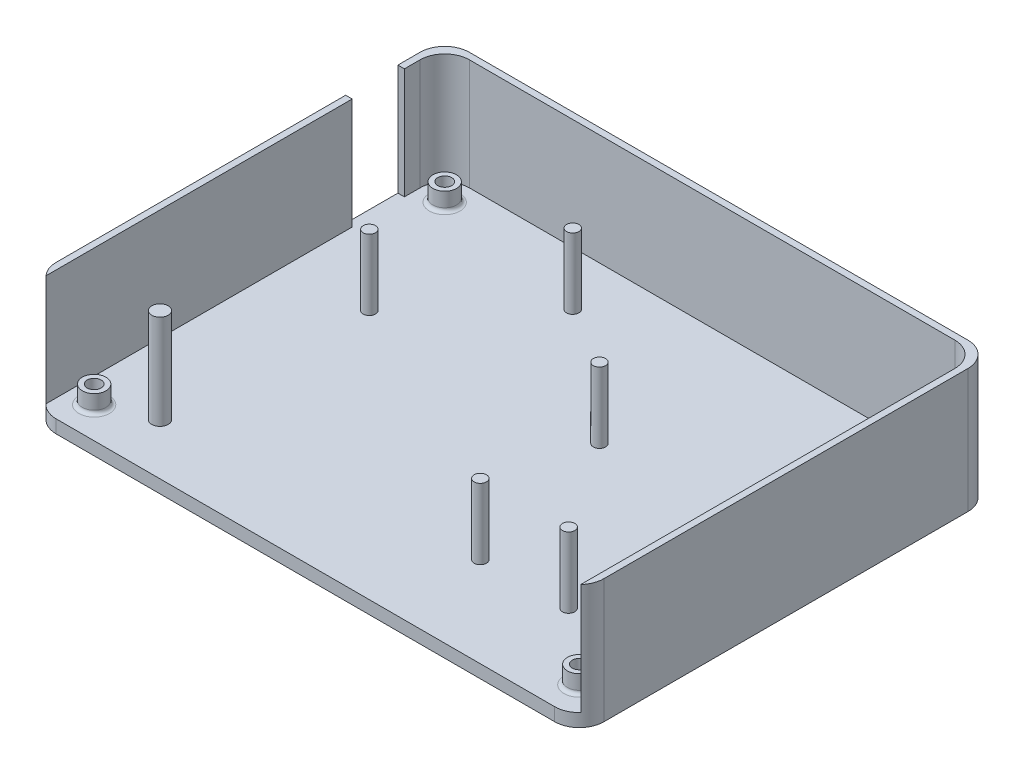
from build123d import *

# Parameters (mm, degrees)
BOSS_EXTRUDE12_DEPTH = 3.175
BOSS_EXTRUDE13_DEPTH = 30.1625
SKETCH1_25_R         = 2.875
SKETCH1_25_R_2       = 1.7
BOSS_EXTRUDE15_DEPTH = 7.525
SKETCH1_27_R         = 1.7
CUT_EXTRUDE3_DEPTH   = 28.575
CHAMFER2_SIZE        = 1.45
SKETCH1_28_R         = 1.5
BOSS_EXTRUDE16_DEPTH = 20.32
SKETCH1_29_R         = 2
BOSS_EXTRUDE17_DEPTH = 26.1874
FILLET3_R            = 6
FILLET4_R            = 0.85
FILLET5_R            = 0.85
SKETCH2_W            = 12.7
SKETCH2_H            = 26.9875
CUT_EXTRUDE4_DEPTH   = 2.54


with BuildPart() as part:
    # Sketch1 → Boss-Extrude12 (new body)
    with BuildSketch(Plane(origin=(0, 0, 0), x_dir=(1, 0, 0), z_dir=(0, 1, 0))):
        with BuildLine():
            Line((-66.858315384, -50.276221126), (-65.270815384, -50.276221126))
            Line((-65.270815384, -50.276221126), (64.85543465, -50.276221126))
            Line((64.85543465, -50.276221126), (66.44293465, -50.276221126))
            Line((66.44293465, -50.276221126), (66.44293465, 44.266274766))
            ThreePointArc((66.44293465, 44.266274766), (64.685575338, 48.508915454), (60.44293465, 50.266274766))
            Line((60.44293465, 50.266274766), (-60.858315384, 50.266274766))
            ThreePointArc((-60.858315384, 50.266274766), (-65.100956071, 48.508915454), (-66.858315384, 44.266274766))
            Line((-66.858315384, 44.266274766), (-66.858315384, -50.276221126))
        make_face()
    extrude(amount=BOSS_EXTRUDE12_DEPTH)

    # Sketch1<23> → Boss-Extrude13 (add)
    with BuildSketch(Plane(origin=(0, 0, 0), x_dir=(1, 0, 0), z_dir=(0, 1, 0))):
        with BuildLine():
            Line((-66.858315384, 44.266274766), (-66.858315384, -50.276221126))
            Line((-66.858315384, -50.276221126), (-65.270815384, -50.276221126))
            Line((-65.270815384, -50.276221126), (-65.270815384, 42.678774766))
            ThreePointArc((-65.270815384, 42.678774766), (-63.513456071, 46.921415454), (-59.270815384, 48.678774766))
            Line((-59.270815384, 48.678774766), (58.85543465, 48.678774766))
            ThreePointArc((58.85543465, 48.678774766), (63.098075338, 46.921415454), (64.85543465, 42.678774766))
            Line((64.85543465, 42.678774766), (64.85543465, -50.276221126))
            Line((64.85543465, -50.276221126), (66.44293465, -50.276221126))
            Line((66.44293465, -50.276221126), (66.44293465, 44.266274766))
            ThreePointArc((66.44293465, 44.266274766), (64.685575338, 48.508915454), (60.44293465, 50.266274766))
            Line((60.44293465, 50.266274766), (-60.858315384, 50.266274766))
            ThreePointArc((-60.858315384, 50.266274766), (-65.100956071, 48.508915454), (-66.858315384, 44.266274766))
        make_face()
    extrude(amount=BOSS_EXTRUDE13_DEPTH)

    # Sketch1<25> → Boss-Extrude15 (add)
    # profile 1 of 4: a face of its own
    with BuildSketch(Plane(origin=(0, 0, 0), x_dir=(1, 0, 0), z_dir=(0, 1, 0))):
        with Locations((-59.238315384, 42.646274766)):
            Circle(SKETCH1_25_R)
        with Locations((-59.238315384, 42.646274766)):
            Circle(SKETCH1_25_R_2, mode=Mode.SUBTRACT)
    # profile 2 of 4: a face of its own
    with BuildSketch(Plane(origin=(0, 0, 0), x_dir=(1, 0, 0), z_dir=(0, 1, 0))):
        with Locations((58.82293465, 42.646274766)):
            Circle(SKETCH1_25_R)
        with Locations((58.82293465, 42.646274766)):
            Circle(SKETCH1_25_R_2, mode=Mode.SUBTRACT)
    # profile 3 of 4: a face of its own
    with BuildSketch(Plane(origin=(0, 0, 0), x_dir=(1, 0, 0), z_dir=(0, 1, 0))):
        with Locations((-59.238315384, -42.656221126)):
            Circle(SKETCH1_25_R)
        with Locations((-59.238315384, -42.656221126)):
            Circle(SKETCH1_25_R_2, mode=Mode.SUBTRACT)
    # profile 4 of 4: a face of its own
    with BuildSketch(Plane(origin=(0, 0, 0), x_dir=(1, 0, 0), z_dir=(0, 1, 0))):
        with Locations((58.82293465, -42.656221126)):
            Circle(SKETCH1_25_R)
        with Locations((58.82293465, -42.656221126)):
            Circle(SKETCH1_25_R_2, mode=Mode.SUBTRACT)
    extrude(amount=BOSS_EXTRUDE15_DEPTH)

    # Sketch1<27> → Cut-Extrude3 (cut)
    with BuildSketch(Plane(origin=(0, 0, 0), x_dir=(1, 0, 0), z_dir=(0, 1, 0))):
        with Locations((-59.238315384, 42.646274766)):
            Circle(SKETCH1_27_R)
        with Locations((58.82293465, 42.646274766)):
            Circle(SKETCH1_27_R)
        with Locations((-59.238315384, -42.656221126)):
            Circle(SKETCH1_27_R)
        with Locations((58.82293465, -42.656221126)):
            Circle(SKETCH1_27_R)
    extrude(amount=CUT_EXTRUDE3_DEPTH, mode=Mode.SUBTRACT)

    # Chamfer2
    chamfer2_edges = [part.edges().sort_by_distance(p)[0] for p in [
        (57.12293465, 0, 42.656221126),
        (57.12293465, 0, -42.646274766),
        (-60.938315384, 0, 42.656221126),
        (-60.938315384, 0, -42.646274766),
    ]]
    chamfer(chamfer2_edges, length=CHAMFER2_SIZE)

    # Sketch1<28> → Boss-Extrude16 (add)
    with BuildSketch(Plane(origin=(0, 0, 0), x_dir=(1, 0, 0), z_dir=(0, 1, 0))):
        with Locations((-21.087205302, 35.652944211)):
            Circle(SKETCH1_28_R)
        with Locations((20.412794756, -28.347055805)):
            Circle(SKETCH1_28_R)
        with Locations((-45.587205324, 10.652944173)):
            Circle(SKETCH1_28_R)
        with Locations((10.41279469, 10.652944173)):
            Circle(SKETCH1_28_R)
        with Locations((41.412794666, -27.847055789)):
            Circle(SKETCH1_28_R)
    extrude(amount=BOSS_EXTRUDE16_DEPTH)

    # Sketch1<29> → Boss-Extrude17 (add)
    with BuildSketch(Plane(origin=(0, 0, 0), x_dir=(1, 0, 0), z_dir=(0, 1, 0))):
        with Locations((-48.051200616, -37.823742724)):
            Circle(SKETCH1_29_R)
    extrude(amount=BOSS_EXTRUDE17_DEPTH)

    # Fillet3
    fillet3_edges = [part.edges().sort_by_distance(p)[0] for p in [
        (66.44293465, 15.08125, 50.276221126),
        (-66.858315384, 15.08125, 50.276221126),
    ]]
    fillet(fillet3_edges, radius=FILLET3_R)

    # Fillet4
    fillet4_edges = [part.edges().sort_by_distance(p)[0] for p in [
        (-62.113315384, 3.175, -42.646274766),
    ]]
    fillet(fillet4_edges, radius=FILLET4_R)

    # Fillet5
    fillet5_edges = [part.edges().sort_by_distance(p)[0] for p in [
        (-62.113315384, 3.175, 42.656221126),
        (55.94793465, 3.175, 42.656221126),
        (55.94793465, 3.175, -42.646274766),
    ]]
    fillet(fillet5_edges, radius=FILLET5_R)

    # Sketch2 → Cut-Extrude4 (cut)
    with BuildSketch(Plane(origin=(-65.270815384, 0, 0), x_dir=(0, 0, -1), z_dir=(1, 0, 0))):
        with Locations((32.519846941, 16.66875)):
            Rectangle(SKETCH2_W, SKETCH2_H)
    extrude(amount=-CUT_EXTRUDE4_DEPTH, mode=Mode.SUBTRACT)


solid = part.part
